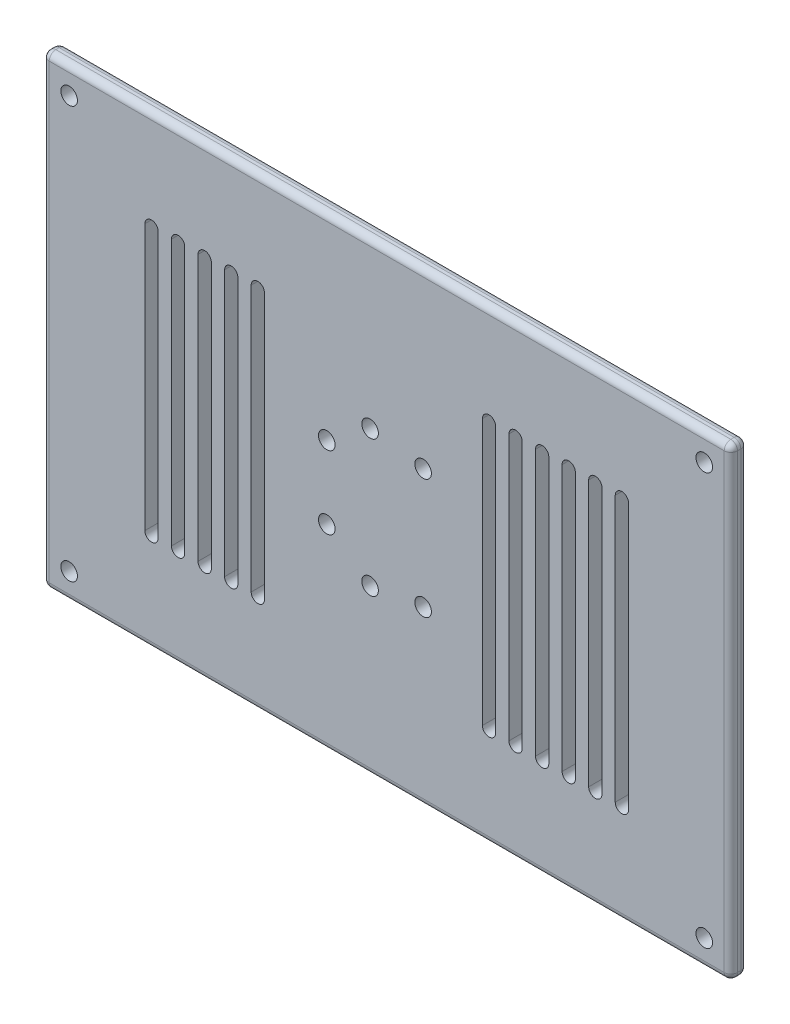
from build123d import *

# Parameters (mm, degrees)
ESQUISSE1_W                                   = 103.6
ESQUISSE1_H                                   = 70
BOSS_EXTRU_1_DEPTH                            = 2.5
CONG_3_R                                      = 1
ESQUISSE17_R                                  = 3
BOSS_EXTRU_12_DEPTH                           = 7
ESQUISSE40_R                                  = 3
BOSS_EXTRU_8_DEPTH                            = 7
ESQUISSE42_R                                  = 3
BOSS_EXTRU_10_DEPTH                           = 7
ENL_V_MAT_EXTRU_2_DEPTH                       = 63.906597428
R_P_TITION_LIN_AIRE1_COUNT                    = 6
R_P_TITION_LIN_AIRE1_PITCH                    = 4
ENL_V_MAT_EXTRU_3_DEPTH                       = 63.906597428
R_P_TITION_LIN_AIRE2_COUNT                    = 5
R_P_TITION_LIN_AIRE2_PITCH                    = 4
TROU_POUR_TARAUDAGE_POUR_TROU_TARAUD_M3_D     = 2.5
TROU_POUR_TARAUDAGE_POUR_TROU_TARAUD_M3_DEPTH = 7
TROU_POUR_TARAUDAGE_POUR_TROU_TARAUD_M3_TIP   = 0.751075774
TROU_POUR_TARAUDAGE_POUR_TROU_TARAUD_2_D      = 2.5
TROU_POUR_TARAUDAGE_POUR_TROU_TARAUD_2_DEPTH  = 7
TROU_POUR_TARAUDAGE_POUR_TROU_TARAUD_2_TIP    = 0.751075774
TROU_POUR_TARAUDAGE_POUR_TROU_TARAUD_3_D      = 2.5
TROU_POUR_TARAUDAGE_POUR_TROU_TARAUD_3_DEPTH  = 7
TROU_POUR_TARAUDAGE_POUR_TROU_TARAUD_3_TIP    = 0.751075774
CONG_4_R                                      = 0.5
TROU_POUR_TARAUDAGE_POUR_TROU_TARAUD_4_D      = 2.5
TROU_POUR_TARAUDAGE_POUR_TROU_TARAUD_4_DEPTH  = 5
TROU_POUR_TARAUDAGE_POUR_TROU_TARAUD_4_TIP    = 0.751075774


with BuildPart() as part:
    # Esquisse1 → Boss.-Extru.1 (new body)
    with BuildSketch(Plane.XY):
        Rectangle(ESQUISSE1_W, ESQUISSE1_H)
    extrude(amount=BOSS_EXTRU_1_DEPTH)

    # Congé3
    cong_3_edges = [part.edges().sort_by_distance(p)[0] for p in [
        (-51.8, 0, 2.5),
        (0, -35, 2.5),
        (0, 35, 2.5),
        (51.8, 0, 2.5),
        (51.8, -35, 1.25),
        (51.8, 35, 1.25),
        (-51.8, 35, 1.25),
        (-51.8, -35, 1.25),
        (51.8, 0, 0),
        (0, 35, 0),
        (-51.8, 0, 0),
        (0, -35, 0),
    ]]
    fillet(cong_3_edges, radius=CONG_3_R)

    # Esquisse17 → Boss.-Extru.12 (add)
    with BuildSketch(Plane.XY.offset(2.5)):
        with Locations((-2.5, 10.25)):
            Circle(ESQUISSE17_R)
        with Locations((-2.5, -10.25)):
            Circle(ESQUISSE17_R)
    extrude(amount=-BOSS_EXTRU_12_DEPTH)

    # Esquisse40 → Boss.-Extru.8 (add)
    with BuildSketch(Plane.XY.offset(2.5)):
        with Locations((5.480077554, -9.01561146)):
            Circle(ESQUISSE40_R)
        with Locations((-9.01561146, 5.480077554)):
            Circle(ESQUISSE40_R)
    extrude(amount=-BOSS_EXTRU_8_DEPTH)

    # Esquisse42 → Boss.-Extru.10 (add)
    with BuildSketch(Plane.XY.offset(2.5)):
        with Locations((-9.01561146, -5.480077554)):
            Circle(ESQUISSE42_R)
        with Locations((5.480077554, 9.01561146)):
            Circle(ESQUISSE42_R)
    extrude(amount=-BOSS_EXTRU_10_DEPTH)

    # Esquisse36 → Enlèv. mat.-Extru.2 (cut, through all)
    with BuildSketch(Plane.XY.offset(2.5)):
        with BuildLine():
            Line((36.4, 20), (36.4, -20))
            ThreePointArc((36.4, -20), (35.4, -21), (34.4, -20))
            Line((34.4, -20), (34.4, 20))
            ThreePointArc((34.4, 20), (35.4, 21), (36.4, 20))
        make_face()
    enl_v_mat_extru_2 = extrude(amount=-ENL_V_MAT_EXTRU_2_DEPTH, mode=Mode.SUBTRACT)

    # Répétition linéaire1: Enlèv. mat.-Extru.2 ×6
    with Locations(*[(-i * R_P_TITION_LIN_AIRE1_PITCH, 0, 0) for i in range(1, R_P_TITION_LIN_AIRE1_COUNT)]):
        add(enl_v_mat_extru_2, mode=Mode.SUBTRACT)

    # Esquisse37 → Enlèv. mat.-Extru.3 (cut, through all)
    with BuildSketch(Plane.XY.offset(2.5)):
        with BuildLine():
            Line((-34.4, 20), (-34.4, -20))
            ThreePointArc((-34.4, -20), (-35.4, -21), (-36.4, -20))
            Line((-36.4, -20), (-36.4, 20))
            ThreePointArc((-36.4, 20), (-35.4, 21), (-34.4, 20))
        make_face()
    enl_v_mat_extru_3 = extrude(amount=-ENL_V_MAT_EXTRU_3_DEPTH, mode=Mode.SUBTRACT)

    # Répétition linéaire2: Enlèv. mat.-Extru.3 ×5
    with Locations(*[(i * R_P_TITION_LIN_AIRE2_PITCH, 0, 0) for i in range(1, R_P_TITION_LIN_AIRE2_COUNT)]):
        add(enl_v_mat_extru_3, mode=Mode.SUBTRACT)

    # Trou pour taraudage pour trou taraud_ M3
    with Locations(Plane(origin=(5.480077554, -9.01561146, 2.5), x_dir=(1, 0, 0), z_dir=(0, 0, 1))):
        with Locations((0, 0), (-14.495689014, 14.495689014)):
            Hole(TROU_POUR_TARAUDAGE_POUR_TROU_TARAUD_M3_D / 2, depth=TROU_POUR_TARAUDAGE_POUR_TROU_TARAUD_M3_DEPTH)
            with Locations((0, 0, -(TROU_POUR_TARAUDAGE_POUR_TROU_TARAUD_M3_DEPTH + TROU_POUR_TARAUDAGE_POUR_TROU_TARAUD_M3_TIP / 2))):  # 118° drill point
                Cone(0, TROU_POUR_TARAUDAGE_POUR_TROU_TARAUD_M3_D / 2, TROU_POUR_TARAUDAGE_POUR_TROU_TARAUD_M3_TIP, mode=Mode.SUBTRACT)

    # Trou pour taraudage pour trou taraud 2
    with Locations(Plane(origin=(5.480077554, 9.01561146, 2.5), x_dir=(1, 0, 0), z_dir=(0, 0, 1))):
        with Locations((0, 0), (-14.495689014, -14.495689014)):
            Hole(TROU_POUR_TARAUDAGE_POUR_TROU_TARAUD_2_D / 2, depth=TROU_POUR_TARAUDAGE_POUR_TROU_TARAUD_2_DEPTH)
            with Locations((0, 0, -(TROU_POUR_TARAUDAGE_POUR_TROU_TARAUD_2_DEPTH + TROU_POUR_TARAUDAGE_POUR_TROU_TARAUD_2_TIP / 2))):  # 118° drill point
                Cone(0, TROU_POUR_TARAUDAGE_POUR_TROU_TARAUD_2_D / 2, TROU_POUR_TARAUDAGE_POUR_TROU_TARAUD_2_TIP, mode=Mode.SUBTRACT)

    # Trou pour taraudage pour trou taraud 3
    with Locations(Plane(origin=(-2.5, 10.25, 2.5), x_dir=(1, 0, 0), z_dir=(0, 0, 1))):
        with Locations((0, 0), (0, -20.5)):
            Hole(TROU_POUR_TARAUDAGE_POUR_TROU_TARAUD_3_D / 2, depth=TROU_POUR_TARAUDAGE_POUR_TROU_TARAUD_3_DEPTH)
            with Locations((0, 0, -(TROU_POUR_TARAUDAGE_POUR_TROU_TARAUD_3_DEPTH + TROU_POUR_TARAUDAGE_POUR_TROU_TARAUD_3_TIP / 2))):  # 118° drill point
                Cone(0, TROU_POUR_TARAUDAGE_POUR_TROU_TARAUD_3_D / 2, TROU_POUR_TARAUDAGE_POUR_TROU_TARAUD_3_TIP, mode=Mode.SUBTRACT)

    # Congé4
    cong_4_edges = [part.edges().sort_by_distance(p)[0] for p in [
        (-5.5, -10.25, 0),
        (-5.5, -10.25, -4.5),
        (-5.5, 10.25, 0),
        (-5.5, 10.25, -4.5),
        (2.480077554, -9.01561146, -4.5),
        (2.480077554, 9.01561146, -4.5),
        (-12.01561146, 5.480077554, 0),
        (-12.01561146, 5.480077554, -4.5),
        (-12.01561146, -5.480077554, 0),
        (-12.01561146, -5.480077554, -4.5),
        (2.480077554, 9.01561146, 0),
        (2.480077554, -9.01561146, 0),
        (6.730077554, -9.01561146, -4.5),
        (6.730077554, 9.01561146, -4.5),
        (-1.25, -10.25, -4.5),
        (-1.25, 10.25, -4.5),
        (-7.76561146, -5.480077554, -4.5),
        (-7.76561146, 5.480077554, -4.5),
    ]]
    fillet(cong_4_edges, radius=CONG_4_R)

    # Trou pour taraudage pour trou taraud 4
    with Locations(Plane(origin=(-47.8, 31, 2.5), x_dir=(1, 0, 0), z_dir=(0, 0, 1))):
        with Locations((0, 0), (0, -62), (95.6, -62), (95.6, 0)):
            Hole(TROU_POUR_TARAUDAGE_POUR_TROU_TARAUD_4_D / 2, depth=TROU_POUR_TARAUDAGE_POUR_TROU_TARAUD_4_DEPTH)
            with Locations((0, 0, -(TROU_POUR_TARAUDAGE_POUR_TROU_TARAUD_4_DEPTH + TROU_POUR_TARAUDAGE_POUR_TROU_TARAUD_4_TIP / 2))):  # 118° drill point
                Cone(0, TROU_POUR_TARAUDAGE_POUR_TROU_TARAUD_4_D / 2, TROU_POUR_TARAUDAGE_POUR_TROU_TARAUD_4_TIP, mode=Mode.SUBTRACT)


solid = part.part
